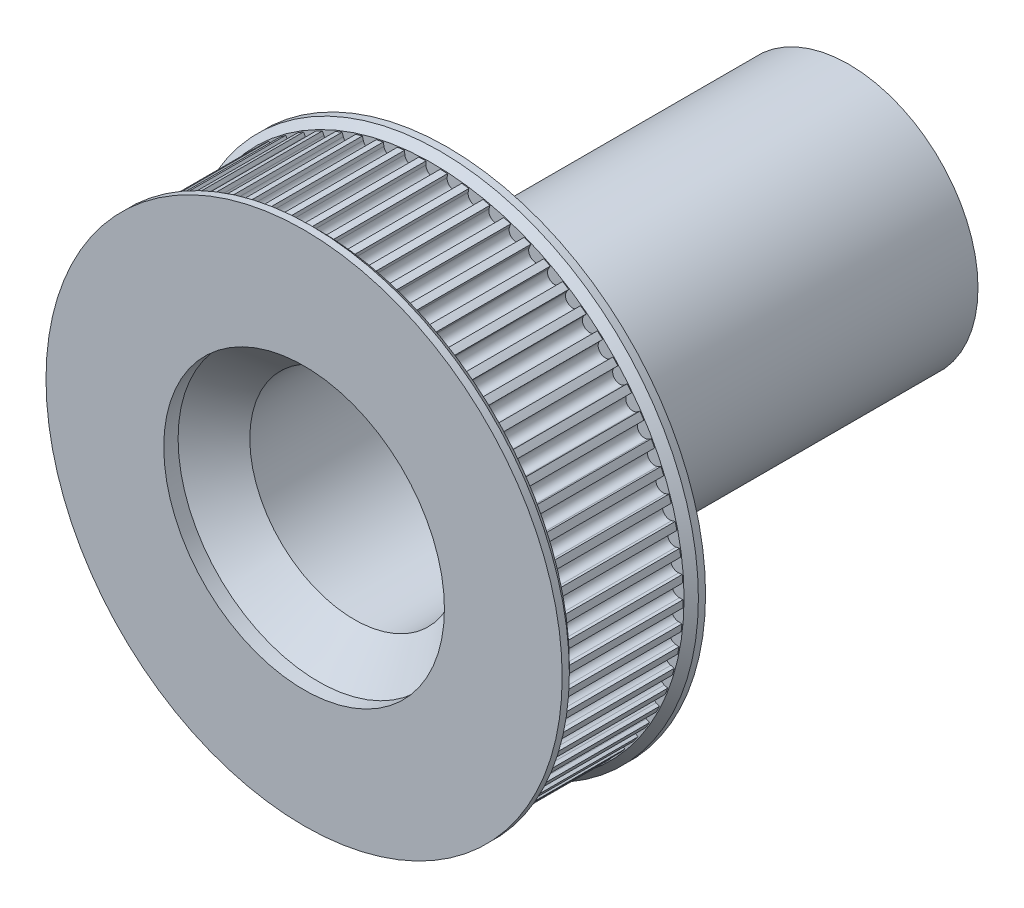
from build123d import *

# Parameters (mm, degrees)
SKETCH1_R           = 18
BOSS_EXTRUDE1_DEPTH = 74
SKETCH2_R           = 14.576002813
CUT_EXTRUDE1_DEPTH  = 85
SKETCH4_R           = 34.85
SKETCH4_R_2         = 14.576002813
BOSS_EXTRUDE2_DEPTH = 18
CUT_EXTRUDE3_START  = -13
SKETCH5_R           = 3.181436575
CUT_EXTRUDE3_DEPTH  = 4
CHAMFER3_SIZE       = 5
CUT_EXTRUDE4_DEPTH  = 18
CIRPATTERN1_COUNT   = 73
SKETCH7_R           = 36
SKETCH7_R_2         = 19.576002813
BOSS_EXTRUDE3_DEPTH = 2
LPATTERN1_COUNT     = 2
LPATTERN1_PITCH     = 18
CHAMFER4_SIZE       = 1
SKETCH_1_R          = 3.5
CUT_EXTRUDE_1_DEPTH = 4


with BuildPart() as part:
    # Sketch1 → Boss-Extrude1 (new body)
    with BuildSketch(Plane.XY):
        Circle(SKETCH1_R)
    extrude(amount=BOSS_EXTRUDE1_DEPTH)

    # Sketch2 → Cut-Extrude1 (cut)
    with BuildSketch(Plane.XY.offset(74)):
        Circle(SKETCH2_R)
    extrude(amount=-CUT_EXTRUDE1_DEPTH, mode=Mode.SUBTRACT)

    # Sketch4 → Boss-Extrude2 (add)
    with BuildSketch(Plane.XY.offset(74)):
        Circle(SKETCH4_R)
        Circle(SKETCH4_R_2, mode=Mode.SUBTRACT)
    extrude(amount=-BOSS_EXTRUDE2_DEPTH)

    # Sketch5 → Cut-Extrude3 (cut)
    with BuildSketch(Plane.XY.offset(74).offset(CUT_EXTRUDE3_START)):
        with Locations((1.618994911, -28.119385301)):
            Circle(SKETCH5_R)
    extrude(amount=-CUT_EXTRUDE3_DEPTH, mode=Mode.SUBTRACT)

    # Chamfer3
    chamfer3_edges = [part.edges().sort_by_distance(p)[0] for p in [
        (-14.576002813, 0, 74),
    ]]
    chamfer(chamfer3_edges, length=CHAMFER3_SIZE)

    # Sketch6 → Cut-Extrude4 (cut)
    with BuildSketch(Plane.XY.offset(74)):
        with BuildLine():
            Line((1, 35.669255209), (1, 34.337502479))
            ThreePointArc((1, 34.337502479), (0, 33.337502479), (-1, 34.337502479))
            Line((-1, 34.337502479), (-1, 35.669255209))
            ThreePointArc((-1, 35.669255209), (0, 36.669255209), (1, 35.669255209))
        make_face()
    cut_extrude4 = extrude(amount=-CUT_EXTRUDE4_DEPTH, mode=Mode.SUBTRACT)

    # CirPattern1: Cut-Extrude4 ×73 about axis
    cirpattern1_axis = Axis((0, 0, 74), (0, 0, 1))
    for i in range(1, CIRPATTERN1_COUNT):
        add(cut_extrude4.rotate(cirpattern1_axis, i * 360 / CIRPATTERN1_COUNT), mode=Mode.SUBTRACT)

    # Sketch7 → Boss-Extrude3 (add)
    with BuildSketch(Plane.XY.offset(74)):
        Circle(SKETCH7_R)
        Circle(SKETCH7_R_2, mode=Mode.SUBTRACT)
    boss_extrude3 = extrude(amount=BOSS_EXTRUDE3_DEPTH)

    # LPattern1: Boss-Extrude3 ×2
    with Locations(*[(0, 0, -i * LPATTERN1_PITCH) for i in range(1, LPATTERN1_COUNT)]):
        add(boss_extrude3)

    # Chamfer4
    chamfer4_edges = [part.edges().sort_by_distance(p)[0] for p in [
        (-36, 0, 74),
        (-36, 0, 58),
    ]]
    chamfer(chamfer4_edges, length=CHAMFER4_SIZE)

    # Эскиз1 → Вырез-Вытянуть1 (cut)
    with BuildSketch(Plane(origin=(0, 0, 56), x_dir=(-1, 0, 0), z_dir=(0, 0, -1))):
        with Locations((-9.411948848, 27.775437053)):
            Circle(SKETCH_1_R)
    extrude(amount=-CUT_EXTRUDE_1_DEPTH, mode=Mode.SUBTRACT)


solid = part.part
